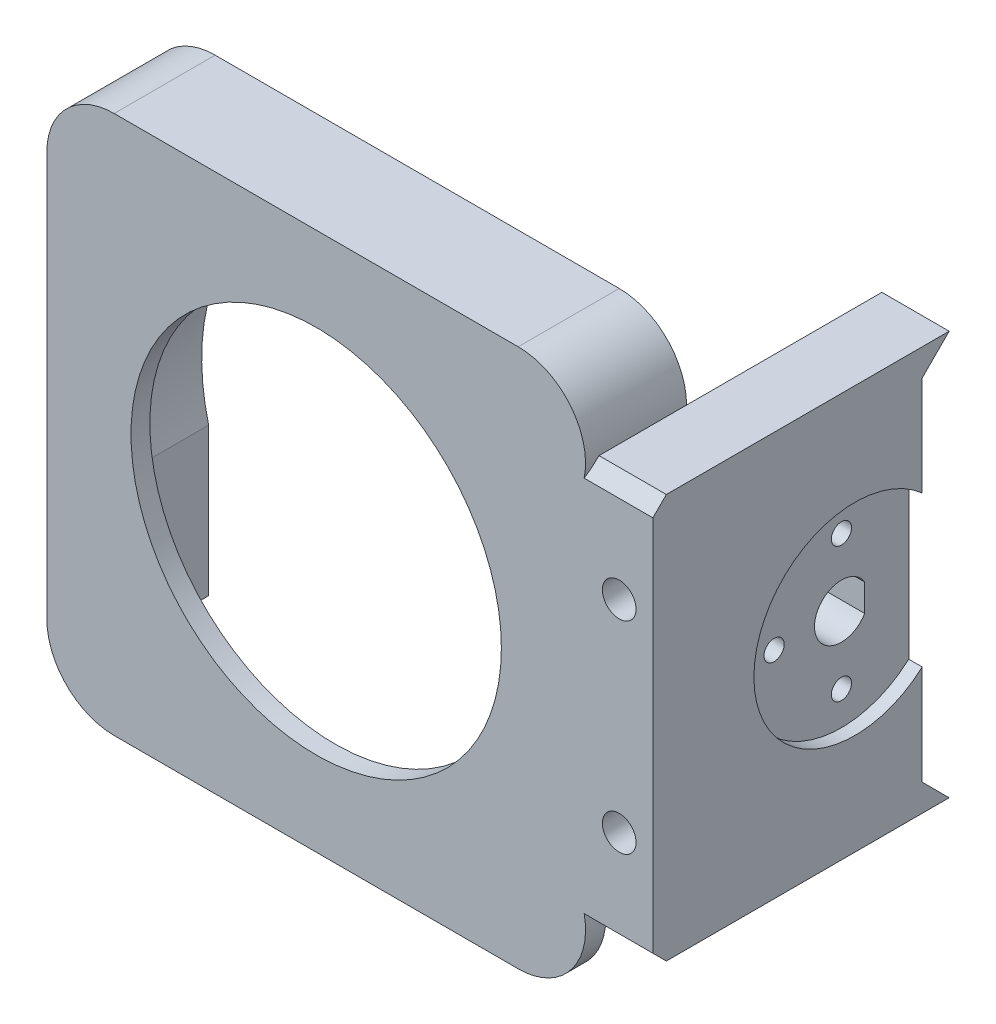
from build123d import *

# Parameters (mm, degrees)
SKETCH1_W           = 80
SKETCH1_H           = 80
SKETCH1_R           = 32
BOSS_EXTRUDE1_DEPTH = 15
BOSS_EXTRUDE2_START = -2.8
SKETCH2_R           = 32
SKETCH2_R_2         = 27.5
BOSS_EXTRUDE2_DEPTH = 2.8
FILLET1_R           = 10
SKETCH4_W           = 40
SKETCH4_H           = 60
BOSS_EXTRUDE3_DEPTH = 10
SKETCH10_R          = 2.5
CUT_EXTRUDE2_DEPTH  = 127.885775404
CHAMFER1_SIZE       = 2
BOSS_EXTRUDE7_DEPTH = 10
CUT_EXTRUDE3_DEPTH  = 10
SKETCH13_R          = 1.5
CUT_EXTRUDE5_DEPTH  = 30
SKETCH14_R          = 15
CUT_EXTRUDE6_DEPTH  = 2
SKETCH16_W          = 60.967741935
SKETCH16_H          = 31.937806786
CUT_EXTRUDE10_DEPTH = 12
SKETCH17_W          = 80
SKETCH17_H          = 10
CUT_EXTRUDE11_DEPTH = 12
SKETCH18_R          = 2
CUT_EXTRUDE12_DEPTH = 20


with BuildPart() as part:
    # Sketch1 → Boss-Extrude1 (new body)
    with BuildSketch(Plane.XY):
        with Locations((40, 40)):
            Rectangle(SKETCH1_W, SKETCH1_H)
        with Locations((40, 40)):
            Circle(SKETCH1_R, mode=Mode.SUBTRACT)
    extrude(amount=BOSS_EXTRUDE1_DEPTH)

    # Sketch2 → Boss-Extrude2 (add)
    with BuildSketch(Plane.XY.offset(15).offset(BOSS_EXTRUDE2_START)):
        with Locations((40, 40)):
            Circle(SKETCH2_R)
        with Locations((40, 40)):
            Circle(SKETCH2_R_2, mode=Mode.SUBTRACT)
    extrude(amount=BOSS_EXTRUDE2_DEPTH)

    # Fillet1
    fillet1_edges = [part.edges().sort_by_distance(p)[0] for p in [
        (80, 0, 7.5),
        (0, 0, 7.5),
        (0, 80, 7.5),
        (80, 80, 7.5),
    ]]
    fillet(fillet1_edges, radius=FILLET1_R)

    # Sketch4 → Boss-Extrude3 (add)
    with BuildSketch(Plane(origin=(80, 0, 0), x_dir=(0, 0, -1), z_dir=(1, 0, 0))):
        with Locations((5, 40)):
            Rectangle(SKETCH4_W, SKETCH4_H)
    extrude(amount=BOSS_EXTRUDE3_DEPTH)

    # Sketch10 → Cut-Extrude2 (cut, through all)
    with BuildSketch(Plane(origin=(0, 0, -25), x_dir=(-1, 0, 0), z_dir=(0, 0, -1))):
        with Locations((-85, 55)):
            Circle(SKETCH10_R)
        with Locations((-85, 25)):
            Circle(SKETCH10_R)
    extrude(amount=-CUT_EXTRUDE2_DEPTH, mode=Mode.SUBTRACT)

    # Chamfer1
    chamfer1_edges = [part.edges().sort_by_distance(p)[0] for p in [
        (85, 10, 15),
        (85, 70, 15),
    ]]
    chamfer(chamfer1_edges, length=CHAMFER1_SIZE)

    # Sketch11 → Boss-Extrude7 (add)
    with BuildSketch(Plane(origin=(90, 0, 0), x_dir=(0, 0, -1), z_dir=(1, 0, 0))):
        Polygon((25, 70), (25, 66), (29, 70), align=None)
        Polygon((25, 14), (29, 10), (25, 10), align=None)
    extrude(amount=-BOSS_EXTRUDE7_DEPTH)

    # Sketch12 → Cut-Extrude3 (cut)
    with BuildSketch(Plane(origin=(90, 0, 0), x_dir=(0, 0, -1), z_dir=(1, 0, 0))):
        with BuildLine():
            Line((18.45172909, 42.02127838), (18.45172909, 37.97872162))
            ThreePointArc((18.45172909, 37.97872162), (11, 40), (18.45172909, 42.02127838))
        make_face()
    extrude(amount=-CUT_EXTRUDE3_DEPTH, mode=Mode.SUBTRACT)

    # Sketch13 → Cut-Extrude5 (cut)
    with BuildSketch(Plane(origin=(90, 0, 0), x_dir=(0, 0, -1), z_dir=(1, 0, 0))):
        with Locations((15, 50)):
            Circle(SKETCH13_R)
        with Locations((15, 30)):
            Circle(SKETCH13_R)
        with Locations((5, 40)):
            Circle(SKETCH13_R)
    extrude(amount=-CUT_EXTRUDE5_DEPTH, mode=Mode.SUBTRACT)

    # Sketch14 → Cut-Extrude6 (cut)
    with BuildSketch(Plane(origin=(90, 0, 0), x_dir=(0, 0, -1), z_dir=(1, 0, 0))):
        with Locations((15, 40)):
            Circle(SKETCH14_R)
    extrude(amount=-CUT_EXTRUDE6_DEPTH, mode=Mode.SUBTRACT)

    # Sketch16 → Cut-Extrude10 (cut)
    with BuildSketch(Plane(origin=(0, 0, 0), x_dir=(-1, 0, 0), z_dir=(0, 0, -1))):
        with Locations((-39.516129033, 15.968903393)):
            Rectangle(SKETCH16_W, SKETCH16_H)
    extrude(amount=-CUT_EXTRUDE10_DEPTH, mode=Mode.SUBTRACT)

    # Sketch17 → Cut-Extrude11 (cut)
    with BuildSketch(Plane(origin=(0, 0, 0), x_dir=(-1, 0, 0), z_dir=(0, 0, -1))):
        with Locations((-40, 5)):
            Rectangle(SKETCH17_W, SKETCH17_H)
    extrude(amount=-CUT_EXTRUDE11_DEPTH, mode=Mode.SUBTRACT)

    # Sketch18 → Cut-Extrude12 (cut)
    with BuildSketch(Plane.XZ.offset(-10)):
        with Locations((5, 6)):
            Circle(SKETCH18_R)
        with Locations((75, 6)):
            Circle(SKETCH18_R)
    extrude(amount=-CUT_EXTRUDE12_DEPTH, mode=Mode.SUBTRACT)


solid = part.part
